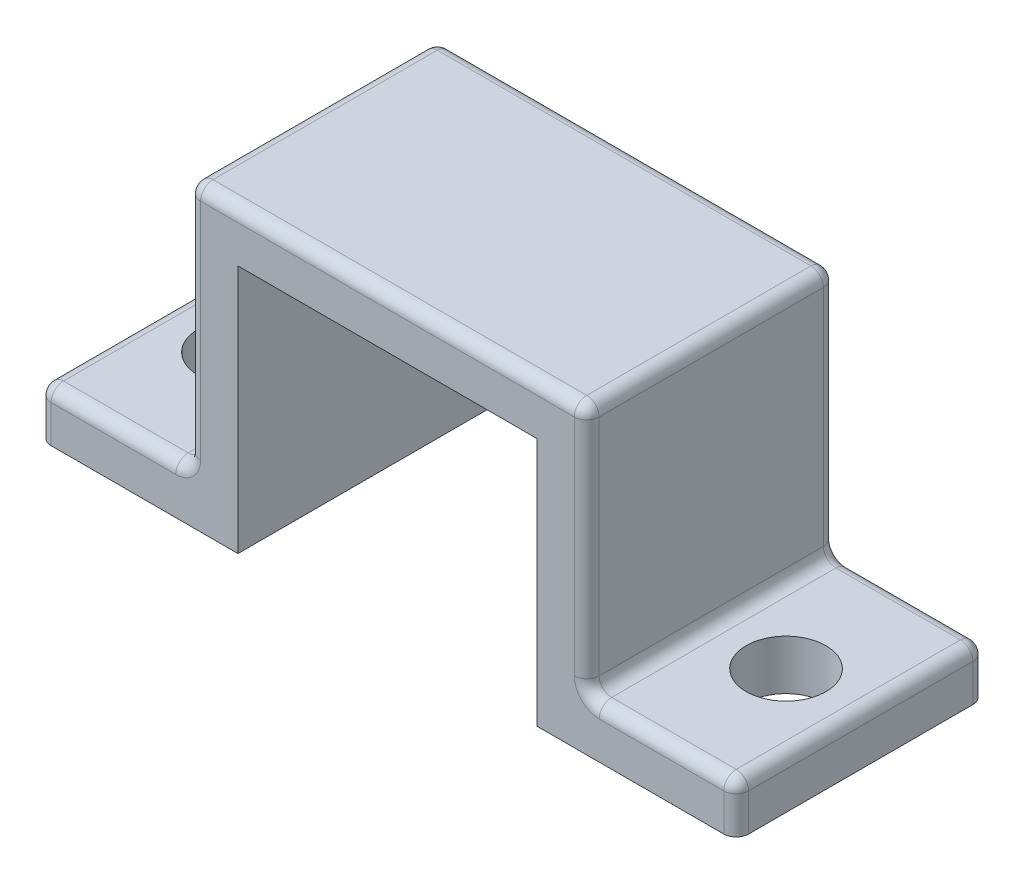
from build123d import *

# Parameters (mm, degrees)
GRUNDK_RPER_DEPTH      = 10
SKIZZE2_W              = 12
SKIZZE2_H              = 10
AUSSCHNITT_MITTE_DEPTH = 21.976176963
SKIZZE3_R              = 1.6
BOHRUNGEN_DEPTH        = 20.899748742
VERRUNDUNG1_R          = 0.5


with BuildPart() as part:
    # Skizze1 → Grundkörper (new body)
    with BuildSketch(Plane.XY):
        Polygon((14, 0), (-14, 0), (-14, 2), (-8, 2), (-8, 12), (8, 12), (8, 2), (14, 2), align=None)
    extrude(amount=GRUNDK_RPER_DEPTH)

    # Skizze2 → Ausschnitt_Mitte (cut, through all)
    with BuildSketch(Plane.XY.offset(10)):
        with Locations((0, 5)):
            Rectangle(SKIZZE2_W, SKIZZE2_H)
    extrude(amount=-AUSSCHNITT_MITTE_DEPTH, mode=Mode.SUBTRACT)

    # Skizze3 → Bohrungen (cut, through all)
    with BuildSketch(Plane(origin=(0, 2, 0), x_dir=(1, 0, 0), z_dir=(0, 1, 0))):
        with Locations((-11, -5)):
            Circle(SKIZZE3_R)
        with Locations((11, -5)):
            Circle(SKIZZE3_R)
    extrude(amount=-BOHRUNGEN_DEPTH, mode=Mode.SUBTRACT)

    # Verrundung1
    verrundung1_edges = [part.edges().sort_by_distance(p)[0] for p in [
        (0, 12, 10),
        (-8, 12, 5),
        (0, 12, 0),
        (14, 2, 5),
        (11, 2, 10),
        (11, 2, 0),
        (8, 2, 5),
        (8, 7, 10),
        (8, 12, 5),
        (8, 7, 0),
        (14, 1, 0),
        (14, 1, 10),
        (-8, 2, 5),
        (-14, 1, 0),
        (-14, 1, 10),
        (-14, 2, 5),
        (-11, 2, 10),
        (-11, 2, 0),
        (-8, 7, 10),
        (-8, 7, 0),
    ]]
    fillet(verrundung1_edges, radius=VERRUNDUNG1_R)


solid = part.part
